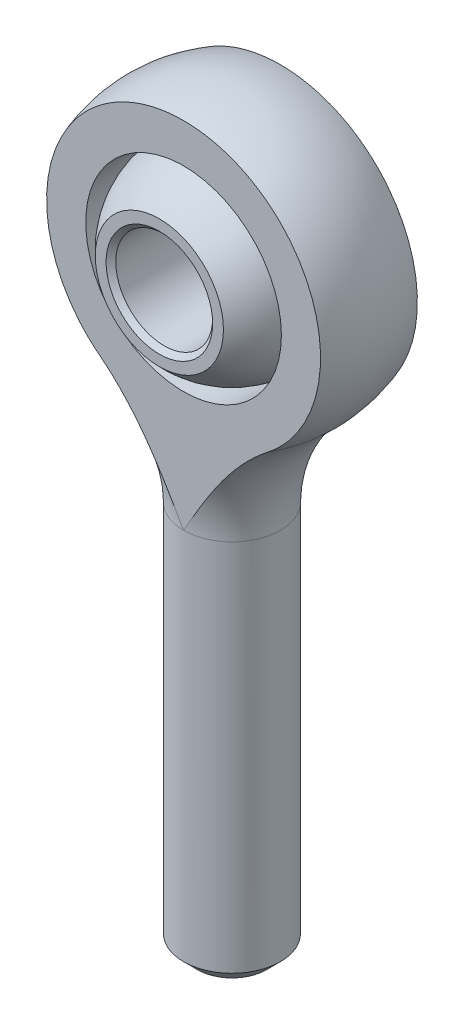
from build123d import *

# Parameters (mm, degrees)
SKETCH1_W               = 3.175
SKETCH1_H               = 25.4
CHAMFER2_SIZE           = 0.90678
CUT_EXTRUDE1_DEPTH      = 29.750847814
CUT_EXTRUDE1_DEPTH_BACK = 29.750847814
CUT_EXTRUDE2_DEPTH      = 28.312382734
CUT_EXTRUDE2_DEPTH_BACK = 28.312382734
SKETCH6_R               = 6.4135
CUT_EXTRUDE3_DEPTH      = 28.86051193
CUT_EXTRUDE3_DEPTH_BACK = 28.86051193
SKETCH8_W               = 4.7625
SKETCH8_H               = 23.8125
CUT_EXTRUDE4_DEPTH      = 28.86051193
CUT_EXTRUDE4_DEPTH_BACK = 28.86051193
SKETCH10_R              = 3.175
CHAMFER1_SIZE           = 0.3175


with BuildPart() as part:
    # Sketch1 → Revolve1 (revolve)
    with BuildSketch(Plane.XY):
        with Locations((1.5875, -12.7)):
            Rectangle(SKETCH1_W, SKETCH1_H)
    revolve(axis=Axis((0, 23.8125, 0), (0, -1, 0)))

    # Chamfer2
    chamfer2_edges = [part.edges().sort_by_distance(p)[0] for p in [
        (-3.175, -25.4, 0),
    ]]
    chamfer(chamfer2_edges, length=CHAMFER2_SIZE)

    # Sketch4 → Revolve2 (revolve)
    with BuildSketch(Plane.XY):
        with BuildLine():
            Line((3.175, 0), (0, 0))
            Line((0, 0), (0, 23.8125))
            ThreePointArc((0, 23.8125), (8.890116899, 17.70677573), (6.382731959, 7.217396907))
            ThreePointArc((6.382731959, 7.217396907), (4.01304802, 3.949061991), (3.175, 0))
        make_face()
    revolve(axis=Axis((0, 23.8125, 0), (0, 1, 0)))

    # Sketch5 → Cut-Extrude1 (cut, two sides: drawn at the far end of the back side and taken through both)
    with BuildSketch(Plane(origin=(0, 0, 0), x_dir=(0, 0, -1), z_dir=(1, 0, 0)).offset(-CUT_EXTRUDE1_DEPTH_BACK)):
        Polygon((3.175, 23.8125), (9.525, 23.8125), (9.525, 0), (3.175, 0), (3.175, 1.27), align=None)
        Polygon((-3.175, 23.8125), (-3.175, 1.27), (-3.175, 0), (-9.525, 0), (-9.525, 23.8125), align=None)
    extrude(amount=CUT_EXTRUDE1_DEPTH + CUT_EXTRUDE1_DEPTH_BACK, mode=Mode.SUBTRACT)

    # Sketch6 → Cut-Extrude2 (cut, two sides: drawn at the far end of the back side and taken through both)
    with BuildSketch(Plane.XY.offset(-CUT_EXTRUDE2_DEPTH_BACK)):
        with Locations((0, 14.2875)):
            Circle(SKETCH6_R)
    extrude(amount=CUT_EXTRUDE2_DEPTH + CUT_EXTRUDE2_DEPTH_BACK, mode=Mode.SUBTRACT)


with BuildPart() as body_2:
    # Sketch7 → Revolve3 (revolve)
    with BuildSketch(Plane.XY):
        with BuildLine():
            Line((0, 20.6375), (0, 7.9375))
            ThreePointArc((0, 7.9375), (6.35, 14.2875), (0, 20.6375))
        make_face()
    revolve(axis=Axis((0, 0, 0), (0, 1, 0)))

    # Sketch8 → Cut-Extrude3 (cut, two sides: drawn at the far end of the back side and taken through both)
    with BuildSketch(Plane(origin=(0, 0, 0), x_dir=(0, 0, -1), z_dir=(1, 0, 0)).offset(-CUT_EXTRUDE3_DEPTH_BACK)):
        with Locations((-7.14375, 11.90625)):
            Rectangle(SKETCH8_W, SKETCH8_H)
        with Locations((7.14375, 11.90625)):
            Rectangle(SKETCH8_W, SKETCH8_H)
    extrude(amount=CUT_EXTRUDE3_DEPTH + CUT_EXTRUDE3_DEPTH_BACK, mode=Mode.SUBTRACT)

    # Sketch10 → Cut-Extrude4 (cut, two sides: drawn at the far end of the back side and taken through both)
    with BuildSketch(Plane.XY.offset(-CUT_EXTRUDE4_DEPTH_BACK)):
        with Locations((0, 14.2875)):
            Circle(SKETCH10_R)
    extrude(amount=CUT_EXTRUDE4_DEPTH + CUT_EXTRUDE4_DEPTH_BACK, mode=Mode.SUBTRACT)

    # Chamfer1
    chamfer1_edges = [body_2.edges().sort_by_distance(p)[0] for p in [
        (-3.175, 14.2875, -4.7625),
        (-3.175, 14.2875, 4.7625),
    ]]
    chamfer(chamfer1_edges, length=CHAMFER1_SIZE)


solid = Compound([part.part, body_2.part])
